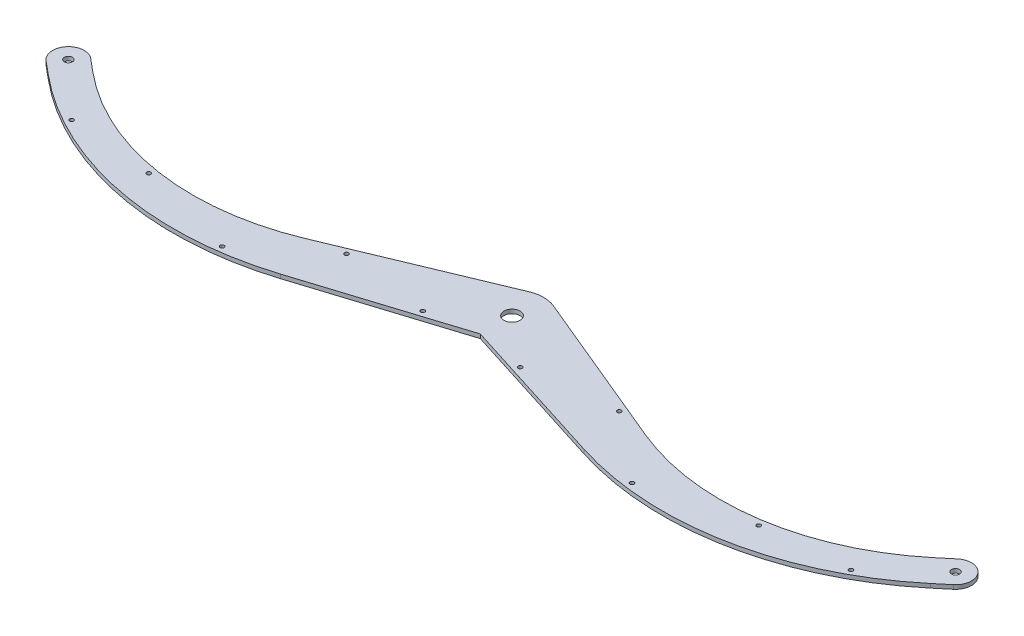
from build123d import *

# Parameters (mm, degrees)
BOSS_EXTRUDE1_DEPTH = 3.18
SKETCH3_R           = 3.175
SKETCH3_R_2         = 1.59
SKETCH3_R_3         = 6.35
CUT_EXTRUDE1_DEPTH  = 371.022926591


with BuildPart() as part:
    # Sketch1 → Boss-Extrude1 (new body)
    with BuildSketch(Plane(origin=(0, 0, 0), x_dir=(1, 0, 0), z_dir=(0, 1, 0))):
        with BuildLine():
            Line((-341.990479357, 9.596748359), (-332.022031203, 1.277004183))
            ThreePointArc((-332.022031203, 1.277004183), (-237.235739686, -41.391581166), (-134.061394526, -28.738370667))
            Line((-134.061394526, -28.738370667), (-9.609504366, 23.079372302))
            ThreePointArc((-9.609504366, 23.079372302), (0, 25), (9.609504366, 23.079372302))
            Line((9.609504366, 23.079372302), (134.061394526, -28.738370667))
            ThreePointArc((134.061394526, -28.738370667), (237.235739686, -41.391581166), (332.022031203, 1.277004183))
            Line((332.022031203, 1.277004183), (341.990479357, 9.596748359))
            ThreePointArc((341.990479357, 9.596748359), (359.596748359, 8.009520643), (358.009520643, -9.596748359))
            Line((358.009520643, -9.596748359), (348.041072489, -17.916492535))
            ThreePointArc((348.041072489, -17.916492535), (239.693311544, -69.594451332), (119.839328065, -62.895841673))
            Line((119.839328065, -62.895841673), (0, -25))
            Line((0, -25), (-119.839328065, -62.895841673))
            ThreePointArc((-119.839328065, -62.895841673), (-239.693311544, -69.594451332), (-348.041072489, -17.916492535))
            Line((-348.041072489, -17.916492535), (-358.009520643, -9.596748359))
            ThreePointArc((-358.009520643, -9.596748359), (-359.596748359, 8.009520643), (-341.990479357, 9.596748359))
        make_face()
    extrude(amount=BOSS_EXTRUDE1_DEPTH)

    # Sketch3 → Cut-Extrude1 (cut, through all)
    with BuildSketch(Plane(origin=(0, 3.18, 0), x_dir=(1, 0, 0), z_dir=(0, 1, 0))):
        with Locations((-350, 0)):
            Circle(SKETCH3_R)
        with Locations((-307.408522979, -40)):
            Circle(SKETCH3_R_2)
        with Locations((-240.642888945, -46)):
            Circle(SKETCH3_R_2)
        with Locations((-161.666323024, -67)):
            Circle(SKETCH3_R_2)
        with Locations((-107.568582774, -23)):
            Circle(SKETCH3_R_2)
        with Locations((38.418745425, -32)):
            Circle(SKETCH3_R_2)
        with Locations((107.568582774, -23)):
            Circle(SKETCH3_R_2)
        with Locations((-38.418745425, -32)):
            Circle(SKETCH3_R_2)
        Circle(SKETCH3_R_3)
        with Locations((161.666323024, -67)):
            Circle(SKETCH3_R_2)
        with Locations((240.642888945, -46)):
            Circle(SKETCH3_R_2)
        with Locations((307.408522979, -40)):
            Circle(SKETCH3_R_2)
        with Locations((350, 0)):
            Circle(SKETCH3_R)
    extrude(amount=-CUT_EXTRUDE1_DEPTH, mode=Mode.SUBTRACT)


solid = part.part
